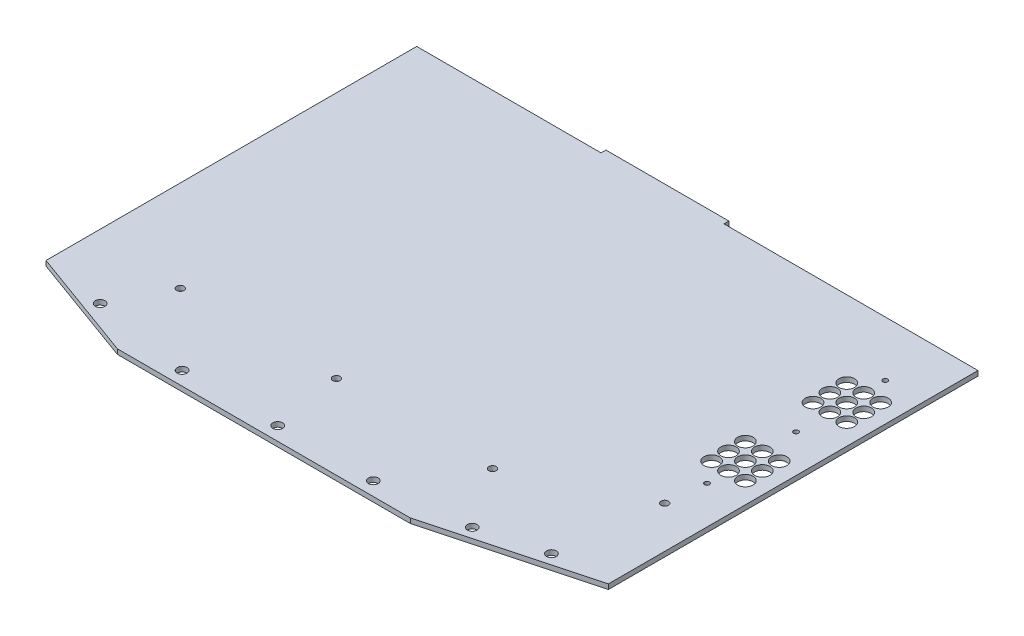
from build123d import *

# Parameters (mm, degrees)
SKETCH1_W               = 308.08168
SKETCH1_H               = 3.175
BOSS_EXTRUDE1_DEPTH     = 267.83
SKETCH3_W               = 267.83
SKETCH3_H               = 3.175
BOSS_EXTRUDE3_DEPTH     = 3.175
SKETCH4_W               = 50.8889
SKETCH4_H               = 3.175
BOSS_EXTRUDE4_DEPTH     = 267.83
CUT_EXTRUDE1_DEPTH      = 340.191055801
CUT_EXTRUDE3_DEPTH      = 340.191055801
SKETCH17_W              = 242.43
SKETCH17_H              = 3.175
BOSS_EXTRUDE5_DEPTH     = 3.175
CUT_EXTRUDE7_DEPTH      = 340.191055801
CUT_EXTRUDE7_DEPTH_BACK = 340.191055801
SKETCH25_R              = 3.175
CUT_EXTRUDE8_DEPTH      = 3.175
SKETCH27_R              = 5
CUT_EXTRUDE9_DEPTH      = 340.191055801
SKETCH30_W              = 80
SKETCH30_H              = 3.175
BOSS_EXTRUDE6_DEPTH     = 3.175
SKETCH31_R              = 1.5875
CUT_EXTRUDE10_DEPTH     = 340.191055801
LPATTERN1_COUNT         = 3
LPATTERN1_PITCH         = 58
M4_CLEARANCE_HOLE1_D    = 4.8


with BuildPart() as part:
    # Sketch1 → Boss-Extrude1 (new body)
    with BuildSketch(Plane.XY):
        Rectangle(SKETCH1_W, SKETCH1_H)
    extrude(amount=BOSS_EXTRUDE1_DEPTH)

    # Sketch3 → Boss-Extrude3 (add)
    with BuildSketch(Plane(origin=(154.04084, 0, 0), x_dir=(0, 0, -1), z_dir=(1, 0, 0))):
        with Locations((-133.915, 0)):
            Rectangle(SKETCH3_W, SKETCH3_H)
    extrude(amount=BOSS_EXTRUDE3_DEPTH)

    # Sketch4 → Boss-Extrude4 (add)
    with BuildSketch(Plane.XY.offset(267.83)):
        with Locations((182.66029, 0)):
            Rectangle(SKETCH4_W, SKETCH4_H)
    extrude(amount=-BOSS_EXTRUDE4_DEPTH)

    # Sketch6 → Cut-Extrude1 (cut, through all)
    with BuildSketch(Plane(origin=(0, 1.5875, 0), x_dir=(1, 0, 0), z_dir=(0, 1, 0))):
        Polygon((208.10474, -240.606362049), (106.50474, -267.83), (208.10474, -267.83), align=None)
    extrude(amount=-CUT_EXTRUDE1_DEPTH, mode=Mode.SUBTRACT)

    # Sketch11 → Cut-Extrude3 (cut, through all)
    with BuildSketch(Plane.XZ.offset(1.5875)):
        Polygon((-154.04084, 242.43), (-84.19084, 267.83), (-154.04084, 267.83), align=None)
    extrude(amount=-CUT_EXTRUDE3_DEPTH, mode=Mode.SUBTRACT)

    # Sketch17 → Boss-Extrude5 (add)
    with BuildSketch(Plane.ZY.offset(154.04084)):
        with Locations((121.215, 0)):
            Rectangle(SKETCH17_W, SKETCH17_H)
    extrude(amount=BOSS_EXTRUDE5_DEPTH)

    # Sketch23 → Cut-Extrude7 (cut, two sides: drawn at the far end of the back side and taken through both)
    with BuildSketch(Plane(origin=(0, 1.5875, 0), x_dir=(1, 0, 0), z_dir=(0, 1, 0)).offset(-CUT_EXTRUDE7_DEPTH_BACK)):
        Polygon((678.249083806, -545.080881384), (-154.04084, -242.43), (-157.21584, -241.275454545), (-989.505763806, 61.375426839), (-1594.807526575, -1603.204420774), (72.947321038, -2209.660728997), align=None)
    extrude(amount=CUT_EXTRUDE7_DEPTH + CUT_EXTRUDE7_DEPTH_BACK, mode=Mode.SUBTRACT)

    # Sketch25 → Cut-Extrude8 (cut)
    with BuildSketch(Plane.XZ.offset(1.5875)):
        with Locations((-115.3206, 247.910027091)):
            Circle(SKETCH25_R)
        with Locations((-50.97526, 258.94)):
            Circle(SKETCH25_R)
        with Locations((11.25474, 258.94)):
            Circle(SKETCH25_R)
        with Locations((73.48474, 258.94)):
            Circle(SKETCH25_R)
        with Locations((172.54474, 242.09298883)):
            Circle(SKETCH25_R)
        with Locations((131.90474, 252.982444011)):
            Circle(SKETCH25_R)
    extrude(amount=-CUT_EXTRUDE8_DEPTH, mode=Mode.SUBTRACT)

    # Sketch27 → Cut-Extrude9 (cut, through all)
    with BuildSketch(Plane.XZ.offset(1.5875)):
        with Locations((172.48674, 137.774823778)):
            Circle(SKETCH27_R)
        with Locations((183.48674, 137.774823778)):
            Circle(SKETCH27_R)
        with Locations((194.48674, 137.774823778)):
            Circle(SKETCH27_R)
        with Locations((194.48674, 126.774823778)):
            Circle(SKETCH27_R)
        with Locations((194.48674, 115.774823778)):
            Circle(SKETCH27_R)
        with Locations((183.48674, 126.774823778)):
            Circle(SKETCH27_R)
        with Locations((183.48674, 115.774823778)):
            Circle(SKETCH27_R)
        with Locations((172.48674, 115.774823778)):
            Circle(SKETCH27_R)
        with Locations((172.48674, 126.774823778)):
            Circle(SKETCH27_R)
        with Locations((194.48674, 71.774823778)):
            Circle(SKETCH27_R)
        with Locations((194.48674, 60.774823778)):
            Circle(SKETCH27_R)
        with Locations((194.48674, 49.774823778)):
            Circle(SKETCH27_R)
        with Locations((183.48674, 71.774823778)):
            Circle(SKETCH27_R)
        with Locations((183.48674, 60.774823778)):
            Circle(SKETCH27_R)
        with Locations((183.48674, 49.774823778)):
            Circle(SKETCH27_R)
        with Locations((172.48674, 49.774823778)):
            Circle(SKETCH27_R)
        with Locations((172.48674, 60.774823778)):
            Circle(SKETCH27_R)
        with Locations((172.48674, 71.774823778)):
            Circle(SKETCH27_R)
    extrude(amount=-CUT_EXTRUDE9_DEPTH, mode=Mode.SUBTRACT)

    # Sketch30 → Boss-Extrude6 (add)
    with BuildSketch(Plane(origin=(0, 0, 0), x_dir=(-1, 0, 0), z_dir=(0, 0, -1))):
        with Locations((-2.78399998, 0)):
            Rectangle(SKETCH30_W, SKETCH30_H)
    extrude(amount=BOSS_EXTRUDE6_DEPTH)

    # Sketch31 → Cut-Extrude10 (cut, symmetric)
    with BuildSketch(Plane.XZ.offset(1.5875)):
        with Locations((183.48674, 151.774823778)):
            Circle(SKETCH31_R)
    cut_extrude10 = extrude(amount=CUT_EXTRUDE10_DEPTH, both=True, mode=Mode.SUBTRACT)

    # LPattern1: Cut-Extrude10 ×3
    with Locations(*[(0, 0, -i * LPATTERN1_PITCH) for i in range(1, LPATTERN1_COUNT)]):
        add(cut_extrude10, mode=Mode.SUBTRACT)

    # M4 Clearance Hole1 (through all)
    with Locations(Plane.XZ.offset(1.5875)):
        with Locations((180.96500002, 176.776), (-97.77095, 213.2849914), (3.82905, 213.2849914), (105.42905, 213.2849914)):
            Hole(M4_CLEARANCE_HOLE1_D / 2)


solid = part.part
